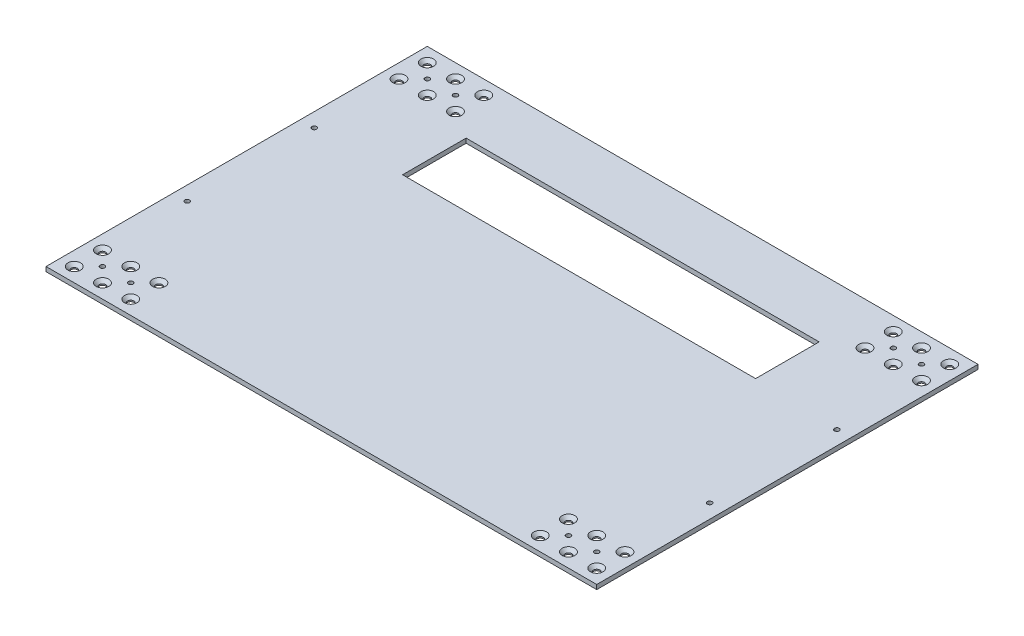
from build123d import *

# Parameters (mm, degrees)
SKETCH1_W                            = 390
SKETCH1_H                            = 270
BOSS_EXTRUDE1_DEPTH                  = 3.175
SKETCH2_W                            = 250
SKETCH2_H                            = 45
CUT_EXTRUDE1_DEPTH                   = 238.192075384
CSK_FOR_M4_SFHCS2_AT_2_COUNT         = 2
CSK_FOR_M4_SFHCS2_AT_2_PITCH         = 20
CSK_FOR_M4_SFHCS2_AT_3_COUNT         = 2
CSK_FOR_M4_SFHCS2_AT_3_PITCH         = 40
CSK_FOR_M4_SFHCS2_AT_4_COUNT         = 2
CSK_FOR_M4_SFHCS2_AT_4_PITCH         = 28.284271247
CSK_FOR_M4_SFHCS2_AT_5_COUNT         = 2
CSK_FOR_M4_SFHCS2_AT_5_PITCH         = 44.72135955
CSK_FOR_M4_SFHCS2_AT_6_COUNT         = 2
CSK_FOR_M4_SFHCS2_AT_6_PITCH         = 20
LPATTERN1_COUNT                      = 2
LPATTERN1_PITCH                      = 230
LPATTERN1_COUNT_DIR2                 = 2
LPATTERN1_PITCH_DIR2                 = 330
M4X0_7_TAPPED_HOLE1_D                = 3.3
MIRROR1_AT_THE_SECOND_PLANE_COPY_1_D = 3.3


with BuildPart() as part:
    # Sketch1 → Boss-Extrude1 (new body)
    with BuildSketch(Plane(origin=(0, 0, 0), x_dir=(1, 0, 0), z_dir=(0, 1, 0))):
        Rectangle(SKETCH1_W, SKETCH1_H)
    extrude(amount=BOSS_EXTRUDE1_DEPTH)

    # Sketch2 → Cut-Extrude1 (cut, through all)
    with BuildSketch(Plane(origin=(0, 3.175, 0), x_dir=(1, 0, 0), z_dir=(0, 1, 0))):
        with Locations((0, 70)):
            Rectangle(SKETCH2_W, SKETCH2_H)
    extrude(amount=-CUT_EXTRUDE1_DEPTH, mode=Mode.SUBTRACT)

    # Sketch4 → CSK for M4 SFHCS2 (revolve, cut)
    with BuildSketch(Plane(origin=(-185, 3.175, 125), x_dir=(0, 0, 1), z_dir=(1, 0, 0))):
        Polygon((0, 0), (0, 3.175), (2.25, 3.175), (2.25, 2.23), (4.48, 0), align=None)
    csk_for_m4_sfhcs2 = revolve(axis=Axis((-185, 9.525, 125), (0, -1, 0)), mode=Mode.SUBTRACT)

    # CSK for M4 SFHCS2 at 2: CSK for M4 SFHCS2 ×2
    with Locations(*[(i * CSK_FOR_M4_SFHCS2_AT_2_PITCH, 0, 0) for i in range(1, CSK_FOR_M4_SFHCS2_AT_2_COUNT)]):
        add(csk_for_m4_sfhcs2, mode=Mode.SUBTRACT)

    # CSK for M4 SFHCS2 at 3: CSK for M4 SFHCS2 ×2
    with Locations(*[(i * CSK_FOR_M4_SFHCS2_AT_3_PITCH, 0, 0) for i in range(1, CSK_FOR_M4_SFHCS2_AT_3_COUNT)]):
        add(csk_for_m4_sfhcs2, mode=Mode.SUBTRACT)

    # CSK for M4 SFHCS2 at 4: CSK for M4 SFHCS2 ×2
    with Locations(*[Vector(0.7071067811865466, 0, -0.7071067811865486) * (i * CSK_FOR_M4_SFHCS2_AT_4_PITCH) for i in range(1, CSK_FOR_M4_SFHCS2_AT_4_COUNT)]):
        add(csk_for_m4_sfhcs2, mode=Mode.SUBTRACT)

    # CSK for M4 SFHCS2 at 5: CSK for M4 SFHCS2 ×2
    with Locations(*[Vector(0.8944271909999155, 0, -0.4472135954999587) * (i * CSK_FOR_M4_SFHCS2_AT_5_PITCH) for i in range(1, CSK_FOR_M4_SFHCS2_AT_5_COUNT)]):
        add(csk_for_m4_sfhcs2, mode=Mode.SUBTRACT)

    # CSK for M4 SFHCS2 at 6: CSK for M4 SFHCS2 ×2
    with Locations(*[(0, 0, -i * CSK_FOR_M4_SFHCS2_AT_6_PITCH) for i in range(1, CSK_FOR_M4_SFHCS2_AT_6_COUNT)]):
        add(csk_for_m4_sfhcs2, mode=Mode.SUBTRACT)

    # LPattern1: CSK for M4 SFHCS2 2 × 2
    with Locations(*[(j * LPATTERN1_PITCH_DIR2, 0, -i * LPATTERN1_PITCH) for i in range(LPATTERN1_COUNT) for j in range(LPATTERN1_COUNT_DIR2) if (i, j) != (0, 0)]):
        add(csk_for_m4_sfhcs2, mode=Mode.SUBTRACT)

    # LPattern1 copy 1 sketch → LPattern1 copy 1 (revolve, cut)
    with BuildSketch(Plane(origin=(165, 3.175, 125), x_dir=(0, 0, 1), z_dir=(1, 0, 0))):
        Polygon((0, 0), (0, 3.175), (2.25, 3.175), (2.25, 2.23), (4.48, 0), align=None)
    revolve(axis=Axis((165, 9.525, 125), (0, -1, 0)), mode=Mode.SUBTRACT)

    # LPattern1 copy 2 sketch → LPattern1 copy 2 (revolve, cut)
    with BuildSketch(Plane(origin=(-165, 3.175, -105), x_dir=(0, 0, 1), z_dir=(1, 0, 0))):
        Polygon((0, 0), (0, 3.175), (2.25, 3.175), (2.25, 2.23), (4.48, 0), align=None)
    revolve(axis=Axis((-165, 9.525, -105), (0, -1, 0)), mode=Mode.SUBTRACT)

    # LPattern1 copy 3 sketch → LPattern1 copy 3 (revolve, cut)
    with BuildSketch(Plane(origin=(165, 3.175, -105), x_dir=(0, 0, 1), z_dir=(1, 0, 0))):
        Polygon((0, 0), (0, 3.175), (2.25, 3.175), (2.25, 2.23), (4.48, 0), align=None)
    revolve(axis=Axis((165, 9.525, -105), (0, -1, 0)), mode=Mode.SUBTRACT)

    # LPattern1 copy 4 sketch → LPattern1 copy 4 (revolve, cut)
    with BuildSketch(Plane(origin=(185, 3.175, 125), x_dir=(0, 0, 1), z_dir=(1, 0, 0))):
        Polygon((0, 0), (0, 3.175), (2.25, 3.175), (2.25, 2.23), (4.48, 0), align=None)
    revolve(axis=Axis((185, 9.525, 125), (0, -1, 0)), mode=Mode.SUBTRACT)

    # LPattern1 copy 5 sketch → LPattern1 copy 5 (revolve, cut)
    with BuildSketch(Plane(origin=(-145, 3.175, -105), x_dir=(0, 0, 1), z_dir=(1, 0, 0))):
        Polygon((0, 0), (0, 3.175), (2.25, 3.175), (2.25, 2.23), (4.48, 0), align=None)
    revolve(axis=Axis((-145, 9.525, -105), (0, -1, 0)), mode=Mode.SUBTRACT)

    # LPattern1 copy 6 sketch → LPattern1 copy 6 (revolve, cut)
    with BuildSketch(Plane(origin=(185, 3.175, -105), x_dir=(0, 0, 1), z_dir=(1, 0, 0))):
        Polygon((0, 0), (0, 3.175), (2.25, 3.175), (2.25, 2.23), (4.48, 0), align=None)
    revolve(axis=Axis((185, 9.525, -105), (0, -1, 0)), mode=Mode.SUBTRACT)

    # LPattern1 copy 7 sketch → LPattern1 copy 7 (revolve, cut)
    with BuildSketch(Plane(origin=(165, 3.175, 105), x_dir=(0, 0, 1), z_dir=(1, 0, 0))):
        Polygon((0, 0), (0, 3.175), (2.25, 3.175), (2.25, 2.23), (4.48, 0), align=None)
    revolve(axis=Axis((165, 9.525, 105), (0, -1, 0)), mode=Mode.SUBTRACT)

    # LPattern1 copy 8 sketch → LPattern1 copy 8 (revolve, cut)
    with BuildSketch(Plane(origin=(-165, 3.175, -125), x_dir=(0, 0, 1), z_dir=(1, 0, 0))):
        Polygon((0, 0), (0, 3.175), (2.25, 3.175), (2.25, 2.23), (4.48, 0), align=None)
    revolve(axis=Axis((-165, 9.525, -125), (0, -1, 0)), mode=Mode.SUBTRACT)

    # LPattern1 copy 9 sketch → LPattern1 copy 9 (revolve, cut)
    with BuildSketch(Plane(origin=(165, 3.175, -125), x_dir=(0, 0, 1), z_dir=(1, 0, 0))):
        Polygon((0, 0), (0, 3.175), (2.25, 3.175), (2.25, 2.23), (4.48, 0), align=None)
    revolve(axis=Axis((165, 9.525, -125), (0, -1, 0)), mode=Mode.SUBTRACT)

    # LPattern1 copy 10 sketch → LPattern1 copy 10 (revolve, cut)
    with BuildSketch(Plane(origin=(185, 3.175, 105), x_dir=(0, 0, 1), z_dir=(1, 0, 0))):
        Polygon((0, 0), (0, 3.175), (2.25, 3.175), (2.25, 2.23), (4.48, 0), align=None)
    revolve(axis=Axis((185, 9.525, 105), (0, -1, 0)), mode=Mode.SUBTRACT)

    # LPattern1 copy 11 sketch → LPattern1 copy 11 (revolve, cut)
    with BuildSketch(Plane(origin=(-145, 3.175, -125), x_dir=(0, 0, 1), z_dir=(1, 0, 0))):
        Polygon((0, 0), (0, 3.175), (2.25, 3.175), (2.25, 2.23), (4.48, 0), align=None)
    revolve(axis=Axis((-145, 9.525, -125), (0, -1, 0)), mode=Mode.SUBTRACT)

    # LPattern1 copy 12 sketch → LPattern1 copy 12 (revolve, cut)
    with BuildSketch(Plane(origin=(185, 3.175, -125), x_dir=(0, 0, 1), z_dir=(1, 0, 0))):
        Polygon((0, 0), (0, 3.175), (2.25, 3.175), (2.25, 2.23), (4.48, 0), align=None)
    revolve(axis=Axis((185, 9.525, -125), (0, -1, 0)), mode=Mode.SUBTRACT)

    # LPattern1 copy 13 sketch → LPattern1 copy 13 (revolve, cut)
    with BuildSketch(Plane(origin=(145, 3.175, 105), x_dir=(0, 0, 1), z_dir=(1, 0, 0))):
        Polygon((0, 0), (0, 3.175), (2.25, 3.175), (2.25, 2.23), (4.48, 0), align=None)
    revolve(axis=Axis((145, 9.525, 105), (0, -1, 0)), mode=Mode.SUBTRACT)

    # LPattern1 copy 14 sketch → LPattern1 copy 14 (revolve, cut)
    with BuildSketch(Plane(origin=(-185, 3.175, -125), x_dir=(0, 0, 1), z_dir=(1, 0, 0))):
        Polygon((0, 0), (0, 3.175), (2.25, 3.175), (2.25, 2.23), (4.48, 0), align=None)
    revolve(axis=Axis((-185, 9.525, -125), (0, -1, 0)), mode=Mode.SUBTRACT)

    # LPattern1 copy 15 sketch → LPattern1 copy 15 (revolve, cut)
    with BuildSketch(Plane(origin=(145, 3.175, -125), x_dir=(0, 0, 1), z_dir=(1, 0, 0))):
        Polygon((0, 0), (0, 3.175), (2.25, 3.175), (2.25, 2.23), (4.48, 0), align=None)
    revolve(axis=Axis((145, 9.525, -125), (0, -1, 0)), mode=Mode.SUBTRACT)

    # M4x0.7 Tapped Hole1 (through all)
    with Locations(Plane(origin=(0, 3.175, 0), x_dir=(1, 0, 0), z_dir=(0, 1, 0))):
        with Locations((-185, -45), (-175, -115), (-155, -115)):
            m4x0_7_tapped_hole1 = Hole(M4X0_7_TAPPED_HOLE1_D / 2)

    # Mirror1: M4x0.7 Tapped Hole1 across plane
    add(m4x0_7_tapped_hole1.mirror(Plane(origin=(0, 0, 0), x_dir=(0, 0, 1), z_dir=(1, 0, 0))), mode=Mode.SUBTRACT)

    # Mirror1 at the second plane: M4x0.7 Tapped Hole1 across plane
    add(m4x0_7_tapped_hole1.mirror(Plane.XY), mode=Mode.SUBTRACT)

    # Mirror1 at the second plane copy 1 (through all)
    with Locations(Plane(origin=(0, 3.175, 0), x_dir=(-1, 0, 0), z_dir=(0, 1, 0))):
        with Locations((-185, -45), (-175, -115), (-155, -115)):
            Hole(MIRROR1_AT_THE_SECOND_PLANE_COPY_1_D / 2)


solid = part.part
